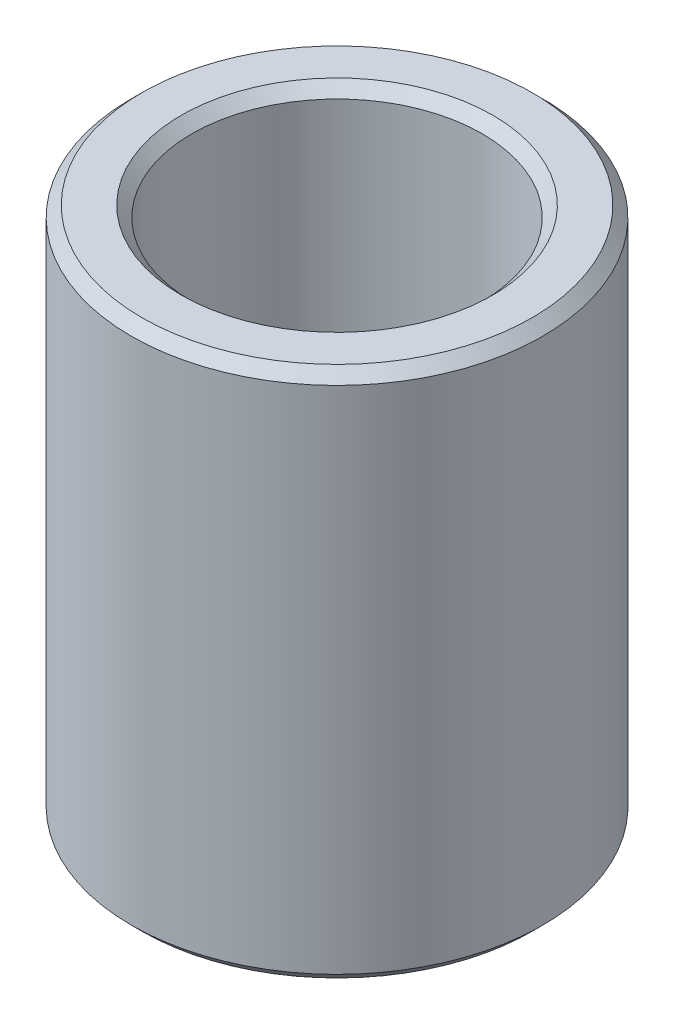
from build123d import *

# Parameters (mm, degrees)
SKETCH1_R           = 45
BOSS_EXTRUDE1_DEPTH = 116.250073126
SKETCH2_R           = 31.748901295
CUT_EXTRUDE1_DEPTH  = 133.529541997
CHAMFER1_SIZE       = 2.334451788


with BuildPart() as part:
    # Sketch1 → Boss-Extrude1 (new body)
    with BuildSketch(Plane(origin=(0, 0, 0), x_dir=(1, 0, 0), z_dir=(0, 1, 0))):
        Circle(SKETCH1_R)
    extrude(amount=BOSS_EXTRUDE1_DEPTH)

    # Sketch2 → Cut-Extrude1 (cut, through all)
    with BuildSketch(Plane(origin=(0, 0, 0), x_dir=(1, 0, 0), z_dir=(0, 1, 0))):
        Circle(SKETCH2_R)
    extrude(amount=CUT_EXTRUDE1_DEPTH, mode=Mode.SUBTRACT)

    # Chamfer1
    chamfer1_edges = [part.edges().sort_by_distance(p)[0] for p in [
        (-31.748901295, 116.250073126, 0),
        (-31.748901295, 0, 0),
        (-45, 0, 0),
        (-45, 116.250073126, 0),
    ]]
    chamfer(chamfer1_edges, length=CHAMFER1_SIZE)


solid = part.part
